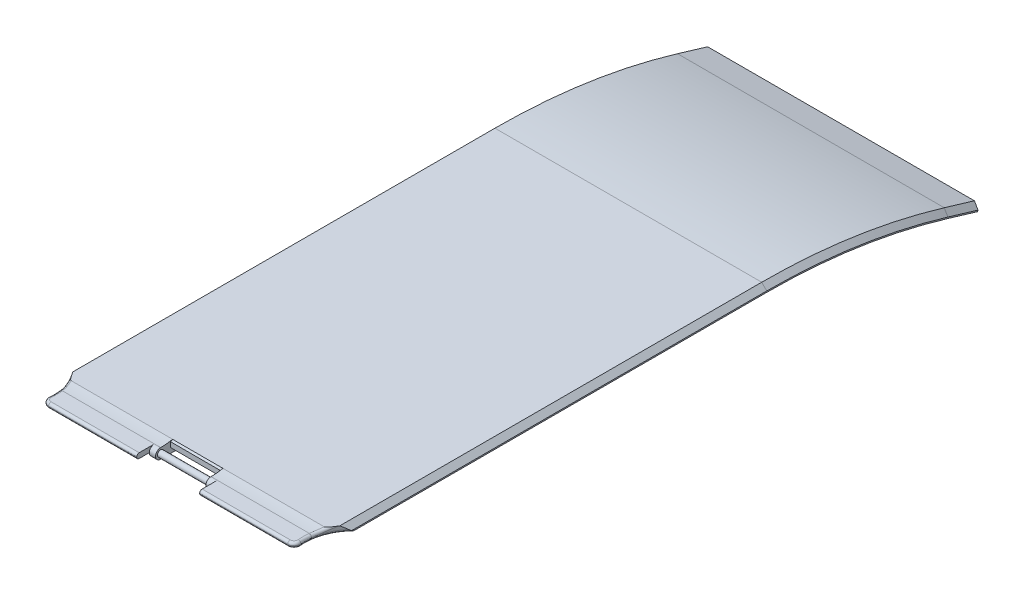
from build123d import *

# Parameters (mm, degrees)
SKETCH1_R           = 0.635
BOSS_EXTRUDE1_DEPTH = 5.08
BOSS_EXTRUDE2_DEPTH = 1.27
BOSS_EXTRUDE3_DEPTH = 27.94
CHAMFER1_SIZE       = 1.016
BOSS_EXTRUDE4_DEPTH = 7.112
CUT_EXTRUDE1_REACH  = 95.615
FILLET1_R           = 11.43
FILLET2_R           = 0.508
BOSS_EXTRUDE5_DEPTH = 6.35
SKETCH10_W          = 38.1
SKETCH10_H          = 0.635
SKETCH10_H_2        = 1.27
CUT_EXTRUDE2_DEPTH  = 5.08


# Some blends are built 0.0001 mm under size
with BuildPart() as part:
    # Sketch1 → Boss-Extrude1 (new, symmetric)
    with BuildSketch(Plane(origin=(0, 0, 0), x_dir=(0, 0, -1), z_dir=(1, 0, 0))):
        Circle(SKETCH1_R)
    extrude(amount=BOSS_EXTRUDE1_DEPTH, both=True)

    # Sketch2 → Boss-Extrude2 (add)
    with BuildSketch(Plane(origin=(5.08, 0, 0), x_dir=(0, 0, -1), z_dir=(1, 0, 0))):
        with BuildLine():
            Line((0, 1.016), (6.35, 1.016))
            Line((6.35, 1.016), (6.35, -1.016))
            Line((6.35, -1.016), (0, -1.016))
            ThreePointArc((0, -1.016), (-1.016, 0), (0, 1.016))
        make_face()
    boss_extrude2 = extrude(amount=BOSS_EXTRUDE2_DEPTH)

    # Mirror1: Boss-Extrude2 across plane
    add(boss_extrude2.mirror(Plane(origin=(0, 0, 0), x_dir=(0, 0, 1), z_dir=(1, 0, 0))))

    # Sketch4 → Boss-Extrude3 (add, symmetric)
    with BuildSketch(Plane(origin=(0, 0, 0), x_dir=(0, 0, -1), z_dir=(1, 0, 0))):
        Polygon((2.032, 1.016), (2.032, 0), (89.3191, 0), (89.3191, 1.27), (2.413, 1.27), align=None)
    extrude(amount=BOSS_EXTRUDE3_DEPTH, both=True)

    # Chamfer1
    chamfer1_edges = [part.edges().sort_by_distance(p)[0] for p in [
        (-27.94, 1.27, -45.86605),
        (27.94, 1.27, -45.86605),
    ]]
    chamfer(chamfer1_edges, length=CHAMFER1_SIZE)

    # Sketch5 → Boss-Extrude4 (add)
    with BuildSketch(Plane.XY.offset(-2.032)):
        Polygon((6.35, 1.016), (27.178, 1.016), (27.94, 0.254), (27.94, 0), (27.178, 0), (6.35, 0), align=None)
        Polygon((-27.94, 0), (-27.178, 0), (-6.35, 0), (-6.35, 1.016), (-27.178, 1.016), (-27.94, 0.254), align=None)
    extrude(amount=BOSS_EXTRUDE4_DEPTH)

    # Sketch6 → Cut-Extrude1 (cut, up to next)
    with BuildSketch(Plane(origin=(0, 1.27, 0), x_dir=(1, 0, 0), z_dir=(0, 1, 0)), mode=Mode.PRIVATE) as cut_extrude1_sk1:
        with BuildLine():
            Line((24.13, -3.556), (6.35, -3.556))
            Line((6.35, -3.556), (6.35, -5.08))
            Line((6.35, -5.08), (27.94, -5.08))
            Line((27.94, -5.08), (27.94, 5.461))
            ThreePointArc((27.94, 5.461), (25.86406568, 1.919644773), (25.4, -2.159))
            ThreePointArc((25.4, -2.159), (25.073995365, -3.138404878), (24.13, -3.556))
        make_face()
    cut_extrude1_tool1 = extrude(cut_extrude1_sk1.sketch, amount=-CUT_EXTRUDE1_REACH, mode=Mode.PRIVATE) & part.part
    # Sketch6 → Cut-Extrude1 (cut, up to next)
    with BuildSketch(Plane(origin=(0, 1.27, 0), x_dir=(1, 0, 0), z_dir=(0, 1, 0)), mode=Mode.PRIVATE) as cut_extrude1_sk2:
        with BuildLine():
            Line((-27.94, -5.08), (-27.94, 5.461))
            ThreePointArc((-27.94, 5.461), (-25.86406568, 1.919644773), (-25.4, -2.159))
            ThreePointArc((-25.4, -2.159), (-25.073995365, -3.138404878), (-24.13, -3.556))
            Line((-24.13, -3.556), (-6.35, -3.556))
            Line((-6.35, -3.556), (-6.35, -5.08))
            Line((-6.35, -5.08), (-27.94, -5.08))
        make_face()
    cut_extrude1_tool2 = extrude(cut_extrude1_sk2.sketch, amount=-CUT_EXTRUDE1_REACH, mode=Mode.PRIVATE) & part.part
    add(cut_extrude1_tool1.solids().sort_by_distance((26.091995, 1.27, -1.843668))[0], mode=Mode.SUBTRACT)
    add(cut_extrude1_tool2.solids().sort_by_distance((-27.699742, 1.27, -0.1905))[0], mode=Mode.SUBTRACT)

    # Fillet1
    # the kernel refuses this fillet: 11.43 mm, written as the material it adds along each edge
    with BuildSketch(Plane(origin=(5.08, 1.016, -2.032), x_dir=(0, 0.5547001962252287, -0.832050294337844), z_dir=(1, 0, 0))) as fillet1_piece_1_section:
        with BuildLine():
            CenterArc((4.663449523, 10.628184011), FILLET1_R, 236.309932474, 12.101492032)
            Line((-1.676773719, 1.117849146), (0, 0))
            Line((0, 0), (0.457905012, 0))
        make_face()
    fillet1_piece_1 = extrude(amount=25.860343839, mode=Mode.PRIVATE)
    fillet1_piece_1 = fillet1_piece_1 - Plane(origin=(35.272791519, 1.208479731, 1.216597173), x_dir=(-0.7393665158371048, 0, -0.6733031674208139), z_dir=(0, 1, 0)) * Cylinder(9.917667845, 59, mode=Mode.PRIVATE)
    add(fillet1_piece_1)
    with BuildSketch(Plane(origin=(-30.940343839, 1.016, -2.032), x_dir=(0, 0.5547001962260483, -0.8320502943372975), z_dir=(1, 0, 0))) as fillet1_piece_2_section:
        with BuildLine():
            CenterArc((4.663449523, 10.628184011), FILLET1_R, 236.309932474, 12.101492032)
            Line((-1.676773719, 1.117849146), (0, 0))
            Line((0, 0), (0.457905012, 0))
        make_face()
    fillet1_piece_2 = extrude(amount=25.860343839, mode=Mode.PRIVATE)
    fillet1_piece_2 = fillet1_piece_2 - Plane(origin=(-35.272791519, 1.208479731, 1.216597173), x_dir=(0.7393665158371048, 0, -0.6733031674208138), z_dir=(0, 1, 0)) * Cylinder(9.917667845, 59, mode=Mode.PRIVATE)
    add(fillet1_piece_2)

    # Fillet2
    fillet2_edges = [part.edges().sort_by_distance(p)[0] for p in [
        (-25.86406568, 0, -1.919644773),
        (-15.24, 0, 3.556),
        (-25.669565682, 1.08391662, -1.260939708),
        (-25.356203761, 1.016, 1.070232197),
        (-15.24, 1.016, 3.556),
        (25.86406568, 0, -1.919644773),
        (25.073995365, 0, 3.138404878),
        (25.669564301, 1.083916034, -1.260934355),
        (25.356203761, 1.016, 1.070232197),
        (25.073995365, 1.016, 3.138404878),
        (-25.073995365, 0, 3.138404878),
        (-25.073995365, 1.016, 3.138404878),
        (15.24, 0, 3.556),
        (15.24, 1.016, 3.556),
    ]]
    fillet(fillet2_edges, radius=FILLET2_R - 0.0001)  # a hair under: the kernel refuses the full size

    # Sweep1: sweep along a path in Sketch8
    with BuildLine(Plane(origin=(0, 0, 0), x_dir=(0, 0, -1), z_dir=(1, 0, 0))) as sweep1_path:
        ThreePointArc((89.3191, 0), (107.756716577, -1.34549632), (125.80366, -5.35347567))
    # Sketch7 → Sweep1 (sweep)
    with BuildSketch(Plane(origin=(0, 0, -89.3191), x_dir=(-1, 0, 0), z_dir=(0, 0, -1))):
        Polygon((-27.94, 0), (-27.94, 0.254), (-26.924, 1.27), (26.924, 1.27), (27.94, 0.254), (27.94, 0), align=None)
    sweep(path=sweep1_path.line)

    # Sketch9 → Boss-Extrude5 (add)
    with BuildSketch(Plane(origin=(0, -35.059237678, -116.894226193), x_dir=(-1, 0, 0), z_dir=(0, -0.28728000000000004, -0.957846648268918))):
        Polygon((-27.94, 31.013066718), (-27.94, 31.267066718), (-26.924, 32.283066718), (26.924, 32.283066718), (27.94, 31.267066718), (27.94, 31.013066718), align=None)
    extrude(amount=BOSS_EXTRUDE5_DEPTH)

    # Sketch10 → Cut-Extrude2 (cut)
    with BuildSketch(Plane(origin=(0, -36.883465678, -122.97655241), x_dir=(-1, 0, 0), z_dir=(0, -0.28727999999993675, -0.9578466482689367))):
        with Locations((0, 31.719186718)):
            Rectangle(SKETCH10_W, SKETCH10_H)
        with Locations((0, 30.449186718)):
            Rectangle(SKETCH10_W, SKETCH10_H_2)
    extrude(amount=-CUT_EXTRUDE2_DEPTH, mode=Mode.SUBTRACT)


solid = part.part
